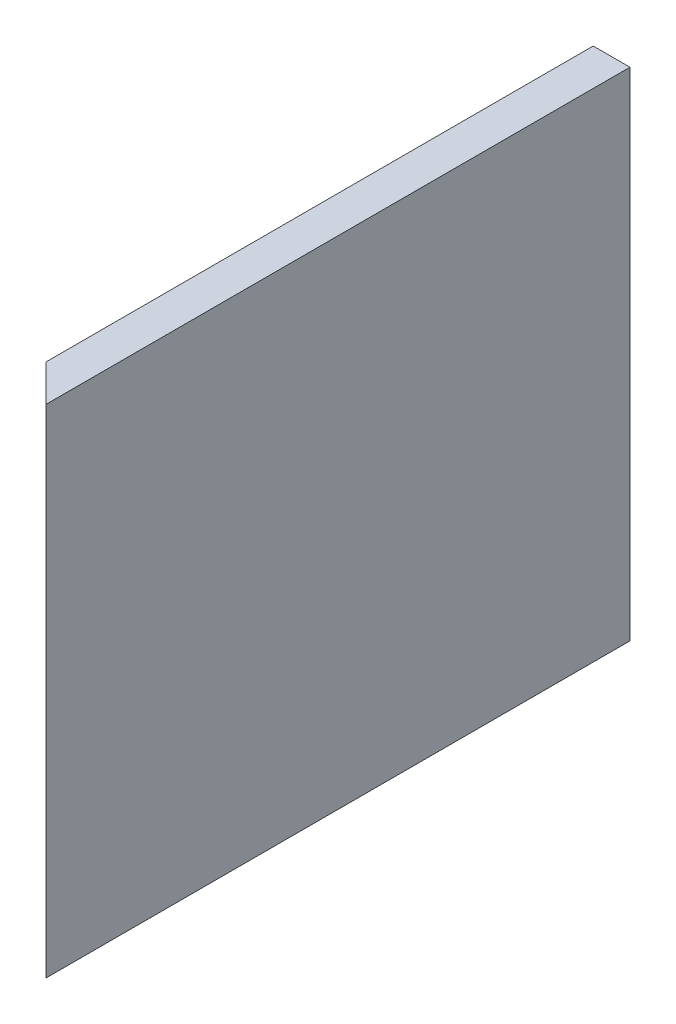
from build123d import *

# Parameters (mm, degrees)
BOSS_EXTRUDE2_REACH = 440.004
SKETCH2_W           = 12.7
SKETCH2_H           = 171.7294


with BuildPart() as part:
    # Boss-Extrude2: up to this plane
    boss_extrude2_end = Plane(origin=(0, 0, 0), z_dir=(-0.7071067811865475, 0, 0.7071067811865477))
    # Sketch2 → Boss-Extrude2 (new, up to the surface)
    with BuildSketch(Plane.XY, mode=Mode.PRIVATE) as boss_extrude2_sk1:
        with Locations((195.4784, 85.8647)):
            Rectangle(SKETCH2_W, SKETCH2_H)
    boss_extrude2_tool1 = split(extrude(boss_extrude2_sk1.sketch, amount=BOSS_EXTRUDE2_REACH, mode=Mode.PRIVATE), bisect_by=boss_extrude2_end, keep=Keep.BOTH, mode=Mode.PRIVATE)
    add(boss_extrude2_tool1.solids().sort_by_distance((195.4784, 85.8647, 0))[0])


solid = part.part
